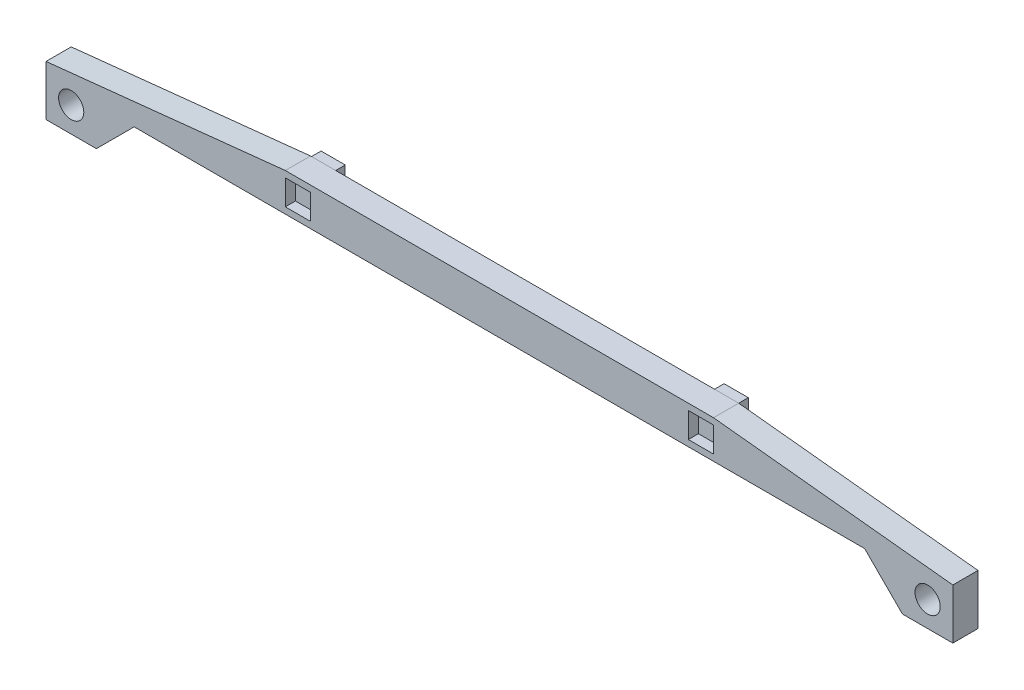
from build123d import *

# Parameters (mm, degrees)
SKETCH2_W           = 180
SKETCH2_H           = 10
SKETCH2_R           = 2.5
BOSS_EXTRUDE1_DEPTH = 2.5
SKETCH3_W           = 5
SKETCH3_H           = 5
BOSS_EXTRUDE2_DEPTH = 7
CHAMFER1_SIZE       = 5
SKETCH4_W           = 5
SKETCH4_H           = 5
SKETCH4_W_2         = 4.8
SKETCH4_H_2         = 4.8
CUT_EXTRUDE1_DEPTH  = 2
CUT_EXTRUDE2_DEPTH  = 91.824005637
BOSS_EXTRUDE3_DEPTH = 5
BOSS_EXTRUDE4_DEPTH = 5
SKETCH8_W           = 5
SKETCH8_H           = 5
CUT_EXTRUDE3_DEPTH  = 2


with BuildPart() as part:
    # Sketch2 → Boss-Extrude1 (new, symmetric)
    with BuildSketch(Plane.XY):
        Rectangle(SKETCH2_W, SKETCH2_H)
        with Locations((-85, 0)):
            Circle(SKETCH2_R, mode=Mode.SUBTRACT)
        with Locations((85, 0)):
            Circle(SKETCH2_R, mode=Mode.SUBTRACT)
    extrude(amount=BOSS_EXTRUDE1_DEPTH, both=True)

    # Sketch3 → Boss-Extrude2 (add)
    with BuildSketch(Plane.XY.offset(2.5)):
        with Locations((-40, 7.5)):
            Rectangle(SKETCH3_W, SKETCH3_H)
        with Locations((40, 7.5)):
            Rectangle(SKETCH3_W, SKETCH3_H)
    extrude(amount=-BOSS_EXTRUDE2_DEPTH)

    # Chamfer1
    chamfer1_edges = [part.edges().sort_by_distance(p)[0] for p in [
        (-37.5, 5, 0),
        (-42.5, 5, 0),
        (37.5, 5, 0),
        (42.5, 5, 0),
    ]]
    chamfer(chamfer1_edges, length=CHAMFER1_SIZE - 0.0001)  # a hair under: the kernel refuses the full size

    # Sketch4 → Cut-Extrude1 (cut)
    # profile 1 of 2: a face of its own
    with BuildSketch(Plane(origin=(0, 0, -4.5), x_dir=(-1, 0, 0), z_dir=(0, 0, -1))):
        with Locations((40, 7.5)):
            Rectangle(SKETCH4_W, SKETCH4_H)
        with Locations((40, 7.5)):
            Rectangle(SKETCH4_W_2, SKETCH4_H_2, mode=Mode.SUBTRACT)
    # profile 2 of 2: a face of its own
    with BuildSketch(Plane(origin=(0, 0, -4.5), x_dir=(-1, 0, 0), z_dir=(0, 0, -1))):
        with Locations((-40, 7.5)):
            Rectangle(SKETCH4_W, SKETCH4_H)
        with Locations((-40, 7.5)):
            Rectangle(SKETCH4_W_2, SKETCH4_H_2, mode=Mode.SUBTRACT)
    extrude(amount=-CUT_EXTRUDE1_DEPTH, mode=Mode.SUBTRACT)

    # Sketch5 → Cut-Extrude2 (cut, through all)
    with BuildSketch(Plane.XY.offset(2.5)):
        Polygon((-80, -5), (-72.5, 2.5), (72.5, 2.5), (80, -5), align=None)
    extrude(amount=-CUT_EXTRUDE2_DEPTH, mode=Mode.SUBTRACT)

    # Sketch6 → Boss-Extrude3 (add)
    with BuildSketch(Plane.XY.offset(2.5)):
        Polygon((-42.5, 10), (-90, 5), (-47.5, 5), align=None)
        Polygon((42.5, 10), (47.5, 5), (90, 5), align=None)
    extrude(amount=-BOSS_EXTRUDE3_DEPTH)

    # Sketch7 → Boss-Extrude4 (add)
    with BuildSketch(Plane.XY.offset(2.5)):
        Polygon((-37.5, 10), (37.5, 10), (32.5, 5), (-32.5, 5), align=None)
    extrude(amount=-BOSS_EXTRUDE4_DEPTH)

    # Sketch8 → Cut-Extrude3 (cut)
    with BuildSketch(Plane.XY.offset(2.5)):
        with Locations((-40, 6.25)):
            Rectangle(SKETCH8_W, SKETCH8_H)
        with Locations((40, 6.25)):
            Rectangle(SKETCH8_W, SKETCH8_H)
    extrude(amount=-CUT_EXTRUDE3_DEPTH, mode=Mode.SUBTRACT)


solid = part.part
